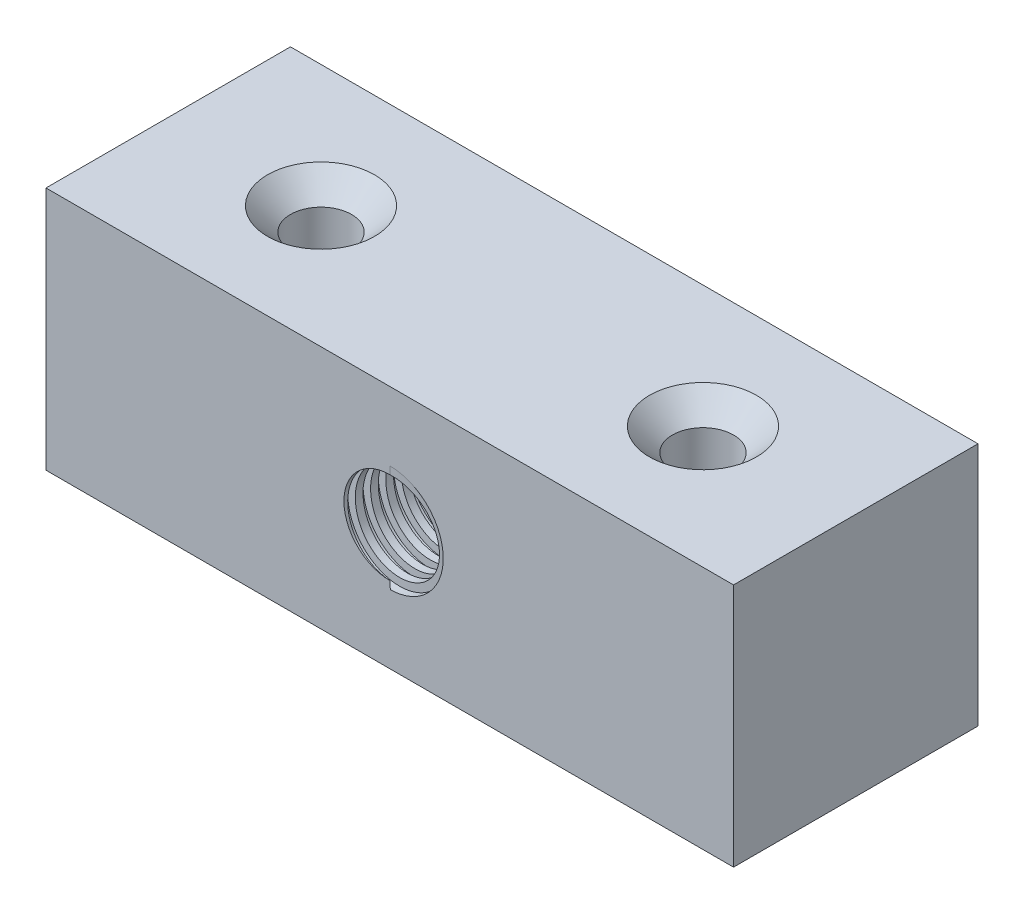
from build123d import *

# Parameters (mm, degrees)
SKETCH1_W             = 90
SKETCH1_H             = 32
BOSS_EXTRUDE1_DEPTH   = 32
F_1_0MM_DOWEL_HOLE1_D = 12
F_1_0MM_DOWEL_HOLE2_D = 8
CHAMFER1_SIZE         = 3
CUT_SWEEP1_PITCH      = 2


with BuildPart() as part:
    # Sketch1 → Boss-Extrude1 (new body)
    with BuildSketch(Plane.XY):
        Rectangle(SKETCH1_W, SKETCH1_H)
    extrude(amount=BOSS_EXTRUDE1_DEPTH)

    # Ø1.0mm Dowel Hole1 (through all)
    with Locations(Plane.XY.offset(32)):
        with Locations((0, 0)):
            Hole(F_1_0MM_DOWEL_HOLE1_D / 2)

    # Ø1.0mm Dowel Hole2 (through all)
    with Locations(Plane(origin=(0, 16, 0), x_dir=(1, 0, 0), z_dir=(0, 1, 0))):
        with Locations((25, -16), (-25, -16)):
            Hole(F_1_0MM_DOWEL_HOLE2_D / 2)

    # Chamfer1
    chamfer1_edges = [part.edges().sort_by_distance(p)[0] for p in [
        (-21, 16, 16),
        (29, 16, 16),
    ]]
    chamfer(chamfer1_edges, length=CHAMFER1_SIZE)

    # Cut-Sweep1: arcs per turn and ends read off the stored shape
    # Cut-Sweep1: the profile of Sketch7 screwed along a right-hand helix through 18 turns, 10 arcs to a turn; built about Z, then put on its axis
    cut_sweep1_z = Axis((0, 0, 0), (0, 0, 1))
    cut_sweep1_corners = [(7.000326346, -0.000145517, -1.500702165), (5.001034256, 0.053062944, -1.500702165), (4.99962484, 0.000104547, -2.499297889), (6.99891693, -0.053103914, -2.499297889)]
    with BuildLine(mode=Mode.PRIVATE) as cut_sweep1_profile:
        Line(cut_sweep1_corners[0], cut_sweep1_corners[1])
        Line(cut_sweep1_corners[1], cut_sweep1_corners[2])
        Line(cut_sweep1_corners[2], cut_sweep1_corners[3])
        Line(cut_sweep1_corners[3], cut_sweep1_corners[0])
    cut_sweep1_cap = Face(cut_sweep1_profile.wire())
    cut_sweep1_turn_angles = [0, 18, 36, 54, 72, 90, 108, 126, 144, 162, 180, 198, 216, 234, 252, 270, 288, 306, 324, 342, 360]
    cut_sweep1_turn_weights = [1, 0.9510565162951535, 1, 0.9510565162951535, 1, 0.9510565162951535, 1, 0.9510565162951535, 1, 0.9510565162951535, 1, 0.9510565162951535, 1, 0.9510565162951535, 1, 0.9510565162951535, 1, 0.9510565162951535, 1, 0.9510565162951535, 1]
    cut_sweep1_turn_rails = [Edge.make_bspline([Vector(p[0], p[1], 0).rotate(cut_sweep1_z, cut_sweep1_turn_angles[k]) / cut_sweep1_turn_weights[k] + Vector(0, 0, p[2] + CUT_SWEEP1_PITCH * cut_sweep1_turn_angles[k] / 360) for k in range(21)], [0, 0, 0, 1, 1, 2, 2, 3, 3, 4, 4, 5, 5, 6, 6, 7, 7, 8, 8, 9, 9, 10, 10, 10], 2, cut_sweep1_turn_weights) for p in cut_sweep1_corners]
    cut_sweep1_turn_sides = [Face.make_surface_from_curves(cut_sweep1_turn_rails[p[0]], cut_sweep1_turn_rails[p[1]]) for p in [(0, 1), (1, 2), (2, 3), (3, 0)]]
    cut_sweep1 = Plane(origin=(0, 0, 32), x_dir=(1, 0, 0), z_dir=(0, 0, -1)) * Solid(Shell([*[p.moved(Location((0, 0, CUT_SWEEP1_PITCH * i))) for i in range(18) for p in cut_sweep1_turn_sides], cut_sweep1_cap, cut_sweep1_cap.rotate(cut_sweep1_z, 6480).moved(Location((0, 0, CUT_SWEEP1_PITCH * 6480 / 360)))]))
    add(cut_sweep1, mode=Mode.SUBTRACT)


solid = part.part
